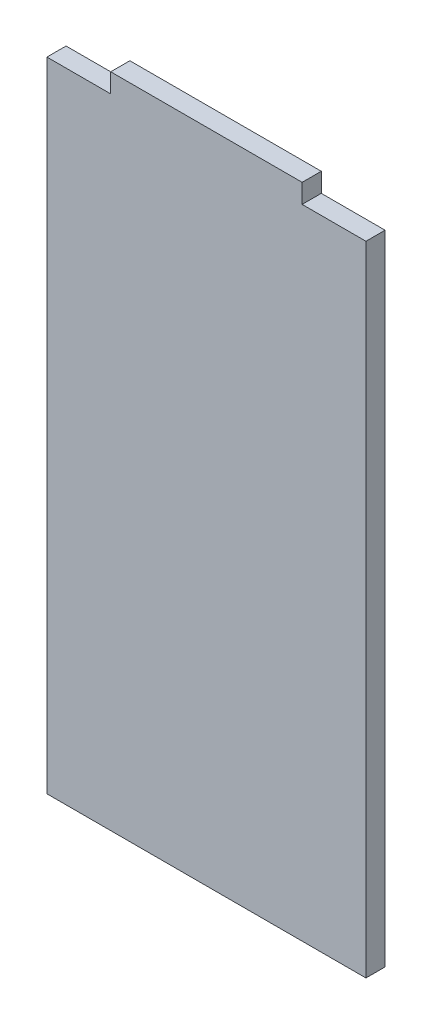
from build123d import *

# Parameters (mm, degrees)
EXTRUDE_1_DEPTH = 3


with BuildPart() as part:
    # Эскиз1 → Бобышка-Вытянуть1 (new body)
    with BuildSketch(Plane.XY):
        Polygon((-25, 50), (-25, -50), (25, -50), (25, 50), (15, 50), (15, 53), (-15, 53), (-15, 50), align=None)
    extrude(amount=EXTRUDE_1_DEPTH)


solid = part.part
